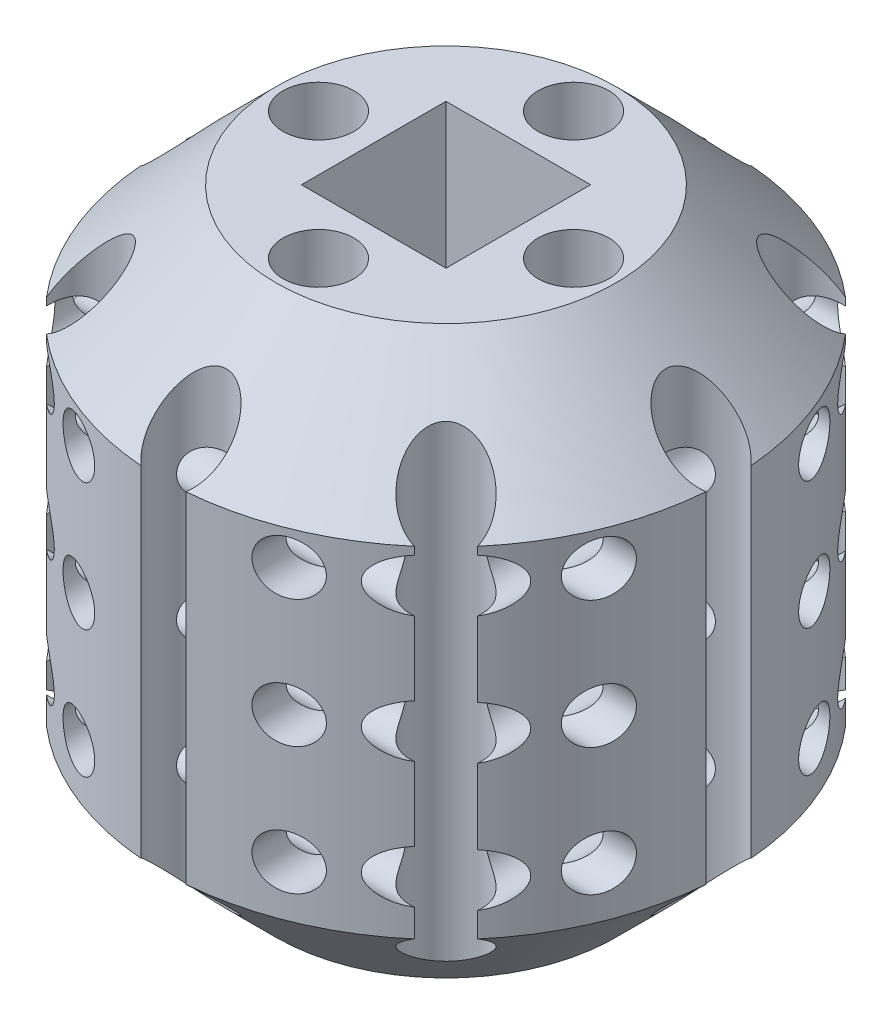
from build123d import *

# Parameters (mm, degrees)
SKETCH1_R           = 6.35
SKETCH1_W           = 3.2385
SKETCH1_H           = 3.2385
BOSS_EXTRUDE1_DEPTH = 6.35
CHAMFER1_SIZE       = 2.54
SKETCH3_R           = 0.79375
CUT_EXTRUDE2_DEPTH  = 16.554259867
SKETCH5_R           = 0.5953125
CUT_EXTRUDE3_DEPTH  = 16.529962838
SKETCH7_R           = 0.5953125
CUT_EXTRUDE4_DEPTH  = 16.529962838


with BuildPart() as part:
    # Sketch1 → Boss-Extrude1 (new, symmetric)
    with BuildSketch(Plane(origin=(0, 0, 0), x_dir=(1, 0, 0), z_dir=(0, 1, 0))):
        Circle(SKETCH1_R)
        Rectangle(SKETCH1_W, SKETCH1_H, mode=Mode.SUBTRACT)
    extrude(amount=BOSS_EXTRUDE1_DEPTH, both=True)

    # Chamfer1
    chamfer1_edges = [part.edges().sort_by_distance(p)[0] for p in [
        (-6.35, -6.35, 0),
        (-6.35, 6.35, 0),
    ]]
    chamfer(chamfer1_edges, length=CHAMFER1_SIZE)

    # Sketch3 → Cut-Extrude2 (cut, through all)
    with BuildSketch(Plane(origin=(0, 6.35, 0), x_dir=(1, 0, 0), z_dir=(0, 1, 0))):
        with Locations((11.43, 0)):
            Circle(SKETCH3_R)
        with Locations((9.898670365, -5.715)):
            Circle(SKETCH3_R)
        with Locations((5.715, -9.898670365)):
            Circle(SKETCH3_R)
        with Locations((0, -11.43)):
            Circle(SKETCH3_R)
        with Locations((-5.715, -9.898670365)):
            Circle(SKETCH3_R)
        with Locations((-9.898670365, -5.715)):
            Circle(SKETCH3_R)
        with Locations((-11.43, 0)):
            Circle(SKETCH3_R)
        with Locations((-9.898670365, 5.715)):
            Circle(SKETCH3_R)
        with Locations((-5.715, 9.898670365)):
            Circle(SKETCH3_R)
        with Locations((0, 11.43)):
            Circle(SKETCH3_R)
        with Locations((5.715, 9.898670365)):
            Circle(SKETCH3_R)
        with Locations((9.898670365, 5.715)):
            Circle(SKETCH3_R)
        with Locations((8.5725, 0)):
            Circle(SKETCH3_R)
        with Locations((5.715, 0)):
            Circle(SKETCH3_R)
        with Locations((2.8575, 0)):
            Circle(SKETCH3_R)
        with Locations((7.424002774, -4.28625)):
            Circle(SKETCH3_R)
        with Locations((4.28625, -7.424002774)):
            Circle(SKETCH3_R)
        with Locations((0, -8.5725)):
            Circle(SKETCH3_R)
        with Locations((-4.28625, -7.424002774)):
            Circle(SKETCH3_R)
        with Locations((-7.424002774, -4.28625)):
            Circle(SKETCH3_R)
        with Locations((-8.5725, 0)):
            Circle(SKETCH3_R)
        with Locations((-7.424002774, 4.28625)):
            Circle(SKETCH3_R)
        with Locations((-4.28625, 7.424002774)):
            Circle(SKETCH3_R)
        with Locations((0, 8.5725)):
            Circle(SKETCH3_R)
        with Locations((4.28625, 7.424002774)):
            Circle(SKETCH3_R)
        with Locations((7.424002774, 4.28625)):
            Circle(SKETCH3_R)
        with Locations((4.041115254, -4.041115254)):
            Circle(SKETCH3_R)
        with Locations((0, -5.715)):
            Circle(SKETCH3_R)
        with Locations((-4.041115254, -4.041115254)):
            Circle(SKETCH3_R)
        with Locations((-5.715, 0)):
            Circle(SKETCH3_R)
        with Locations((-4.041115254, 4.041115254)):
            Circle(SKETCH3_R)
        with Locations((0, 5.715)):
            Circle(SKETCH3_R)
        with Locations((4.041115254, 4.041115254)):
            Circle(SKETCH3_R)
        with Locations((0, -2.8575)):
            Circle(SKETCH3_R)
        with Locations((-2.8575, 0)):
            Circle(SKETCH3_R)
        with Locations((0, 2.8575)):
            Circle(SKETCH3_R)
    extrude(amount=-CUT_EXTRUDE2_DEPTH, mode=Mode.SUBTRACT)

    # Sketch5 → Cut-Extrude3 (cut, through all)
    with BuildSketch(Plane.ZY.offset(6.35)):
        with Locations((-4.74265625, 3.048)):
            Circle(SKETCH5_R)
        with Locations((-4.74265625, 0.22225)):
            Circle(SKETCH5_R)
        with Locations((-4.74265625, -2.6035)):
            Circle(SKETCH5_R)
        with Locations((-2.413, 3.048)):
            Circle(SKETCH5_R)
        with Locations((-2.413, 0.1905)):
            Circle(SKETCH5_R)
        with Locations((-2.413, -2.667)):
            Circle(SKETCH5_R)
        with Locations((2.413, -2.667)):
            Circle(SKETCH5_R)
        with Locations((4.74265625, -2.6035)):
            Circle(SKETCH5_R)
        with Locations((4.74265625, 0.22225)):
            Circle(SKETCH5_R)
        with Locations((2.413, 0.1905)):
            Circle(SKETCH5_R)
        with Locations((2.413, 3.048)):
            Circle(SKETCH5_R)
        with Locations((4.74265625, 3.048)):
            Circle(SKETCH5_R)
    extrude(amount=-CUT_EXTRUDE3_DEPTH, mode=Mode.SUBTRACT)

    # Sketch7 → Cut-Extrude4 (cut, through all)
    with BuildSketch(Plane(origin=(0, 0, -6.35), x_dir=(-1, 0, 0), z_dir=(0, 0, -1))):
        with Locations((-4.74265625, 3.048)):
            Circle(SKETCH7_R)
        with Locations((-2.350277074, 3.048)):
            Circle(SKETCH7_R)
        with Locations((-4.74265625, 0.1905)):
            Circle(SKETCH7_R)
        with Locations((-2.350277074, 0.1905)):
            Circle(SKETCH7_R)
        with Locations((-4.74265625, -2.667)):
            Circle(SKETCH7_R)
        with Locations((-2.350277074, -2.667)):
            Circle(SKETCH7_R)
        with Locations((2.370120824, -2.667)):
            Circle(SKETCH7_R)
        with Locations((4.7625, -2.667)):
            Circle(SKETCH7_R)
        with Locations((4.7625, 0.1905)):
            Circle(SKETCH7_R)
        with Locations((2.370120824, 0.1905)):
            Circle(SKETCH7_R)
        with Locations((2.370120824, 3.048)):
            Circle(SKETCH7_R)
        with Locations((4.7625, 3.048)):
            Circle(SKETCH7_R)
    extrude(amount=-CUT_EXTRUDE4_DEPTH, mode=Mode.SUBTRACT)


solid = part.part
